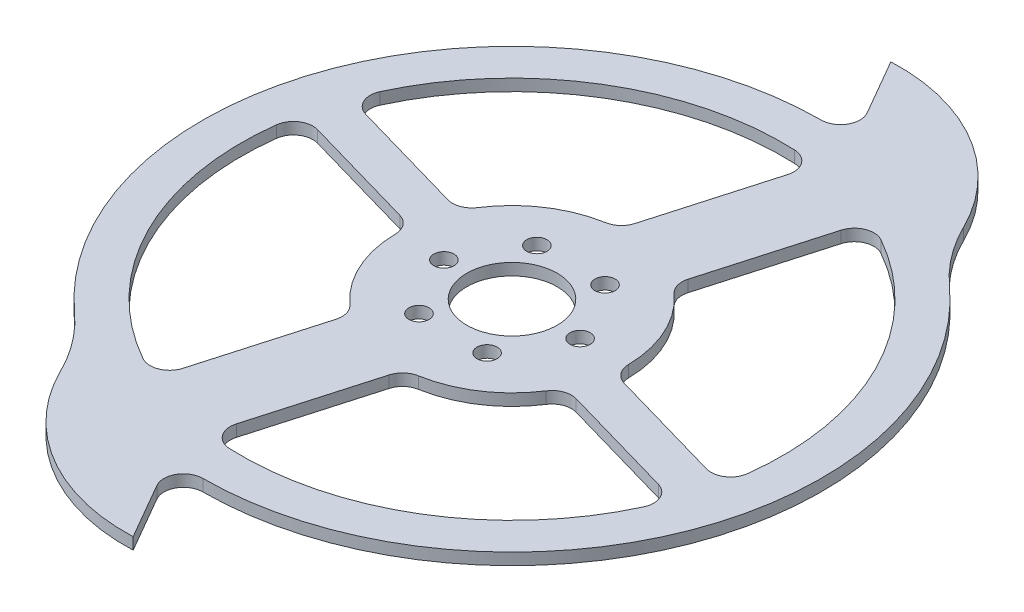
from build123d import *

# Parameters (mm, degrees)
BOSS_EXTRUDE1_DEPTH = 3.02
CIRPATTERN1_COUNT   = 2
SKETCH1_R           = 2.6
SKETCH1_R_2         = 11.6
CUT_EXTRUDE2_DEPTH  = 130.069365143


with BuildPart() as part:
    # Sketch2 → Boss-Extrude1 (new body)
    with BuildSketch(Plane(origin=(0, 0, 0), x_dir=(1, 0, 0), z_dir=(0, 1, 0))):
        with BuildLine():
            Line((-4.161228158, 101.514748585), (4.161228158, 87.099831402))
            ThreePointArc((4.161228158, 87.099831402), (4.163721552, 82.10415507), (-0.158916659, 79.599841366))
            ThreePointArc((-0.158916659, 79.599841366), (-28.43136268, -74.349294658), (53.23011619, 59.183737043))
            ThreePointArc((53.23011619, 59.183737043), (46.891588755, 66.085954254), (41.977994144, 74.065560791))
            ThreePointArc((41.977994144, 74.065560791), (22.986383128, 94.644847664), (-4.161228158, 101.514748585))
        make_face()
        with BuildLine():
            Line((7.680011273, 63.159935298), (-1.062866468, 32.620857053))
            ThreePointArc((-1.062866468, 32.620857053), (-2.529941445, 30.276030126), (-5.019070974, 29.069897257))
            ThreePointArc((-5.019070974, 29.069897257), (-16.275903038, 24.603759475), (-24.789767967, 15.99116644))
            ThreePointArc((-24.789767967, 15.99116644), (-27.232236457, 14.021228007), (-30.36756499, 13.894639132))
            Line((-30.36756499, 13.894639132), (-59.98032233, 22.372325162))
            ThreePointArc((-59.98032233, 22.372325162), (-63.151384657, 25.100052051), (-63.14010821, 29.282874436))
            ThreePointArc((-63.14010821, 29.282874436), (-36.143041074, 59.479749343), (3.095494231, 69.531129111))
            ThreePointArc((3.095494231, 69.531129111), (6.931616712, 67.456449694), (7.680011273, 63.159935298))
        make_face(mode=Mode.SUBTRACT)
        with BuildLine():
            Line((26.907589281, 57.65536956), (18.16471154, 27.116291315))
            ThreePointArc((18.16471154, 27.116291315), (18.168646707, 24.350336358), (19.642387775, 22.009693376))
            ThreePointArc((19.642387775, 22.009693376), (12.263095379, -26.830327835), (-29.496570555, -0.449806059))
            ThreePointArc((-29.496570555, -0.449806059), (-30.526515919, 2.514232115), (-33.119847859, 4.280850128))
            Line((-33.119847859, 4.280850128), (-62.732605199, 12.758536158))
            ThreePointArc((-62.732605199, 12.758536158), (-66.866753517, 12.122180953), (-69.070723928, 8.567093797))
            ThreePointArc((-69.070723928, 8.567093797), (31.341693725, -62.143851139), (34.16916519, 60.635205534))
            ThreePointArc((34.16916519, 60.635205534), (29.816305124, 60.904908376), (26.907589281, 57.65536956))
        make_face(mode=Mode.SUBTRACT)
    extrude(amount=BOSS_EXTRUDE1_DEPTH)


with BuildPart() as cirpattern1_1:
    # CirPattern1: pattern copy
    add(part.part.rotate(Axis((0, -0.15, 0), (0, 1, 0)), 1 * 360 / CIRPATTERN1_COUNT))


with BuildPart() as part_1:
    add(part.part)

    # Combine1: union CirPattern1_1
    add(cirpattern1_1.part)

    # Sketch1 → Cut-Extrude2 (cut, through all)
    with BuildSketch(Plane(origin=(0, 0, 0), x_dir=(1, 0, 0), z_dir=(0, 1, 0))):
        with Locations((8.75, 15.155444566)):
            Circle(SKETCH1_R)
        with Locations((17.5, 0)):
            Circle(SKETCH1_R)
        with Locations((8.75, -15.155444566)):
            Circle(SKETCH1_R)
        with Locations((-8.75, -15.155444566)):
            Circle(SKETCH1_R)
        with Locations((-17.5, 0)):
            Circle(SKETCH1_R)
        with Locations((-8.75, 15.155444566)):
            Circle(SKETCH1_R)
        Circle(SKETCH1_R_2)
    extrude(amount=CUT_EXTRUDE2_DEPTH, mode=Mode.SUBTRACT)


solid = part_1.part
